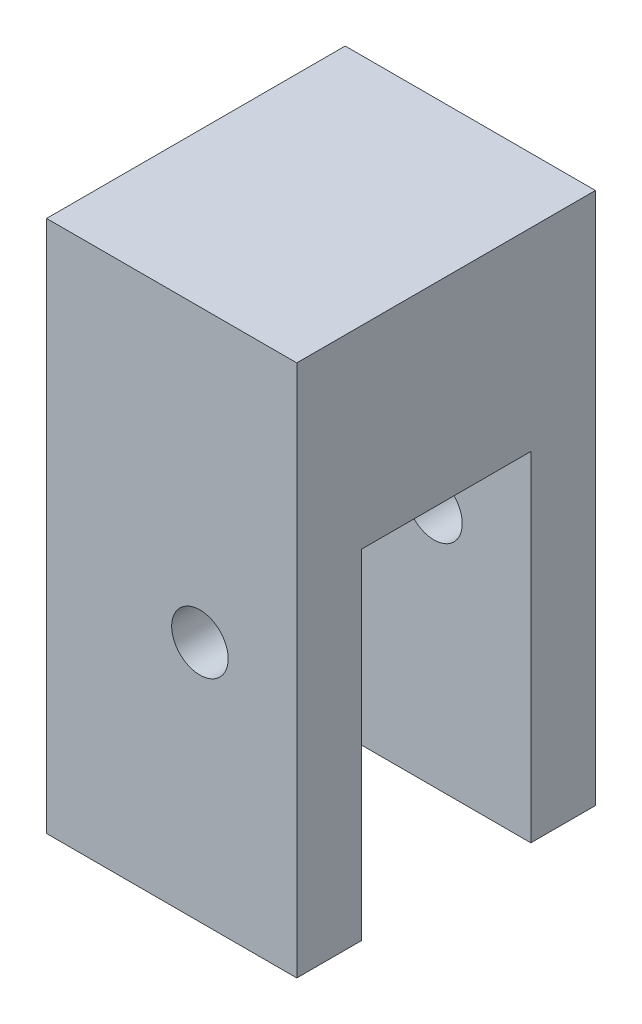
from build123d import *

# Parameters (mm, degrees)
EXTRUDE_1_DEPTH     = 21
SKETCH_2_W          = 15.5
SKETCH_2_H          = 12
EXTRUDE_2_DEPTH     = 18.5
SKETCH_4_R          = 1.75
CUT_EXTRUDE_2_DEPTH = 41.883982194


with BuildPart() as part:
    # ｽｹｯﾁ1 → ﾎﾞｽ - 押し出し1 (new body)
    with BuildSketch(Plane(origin=(0, 0, 0), x_dir=(1, 0, 0), z_dir=(0, 1, 0))):
        Polygon((0, 18.5), (0, 0), (15.5, 0), (15.5, 4), (4, 4), (4, 14.5), (15.5, 14.5), (15.5, 18.5), align=None)
    extrude(amount=EXTRUDE_1_DEPTH)

    # ｽｹｯﾁ2 → ﾎﾞｽ - 押し出し2 (add)
    with BuildSketch(Plane.XY):
        with Locations((7.75, 27)):
            Rectangle(SKETCH_2_W, SKETCH_2_H)
    extrude(amount=-EXTRUDE_2_DEPTH)

    # ｽｹｯﾁ4 → ｶｯﾄ - 押し出し2 (cut, through all)
    with BuildSketch(Plane.XY):
        with Locations((9.5, 15)):
            Circle(SKETCH_4_R)
    extrude(amount=-CUT_EXTRUDE_2_DEPTH, mode=Mode.SUBTRACT)


solid = part.part
